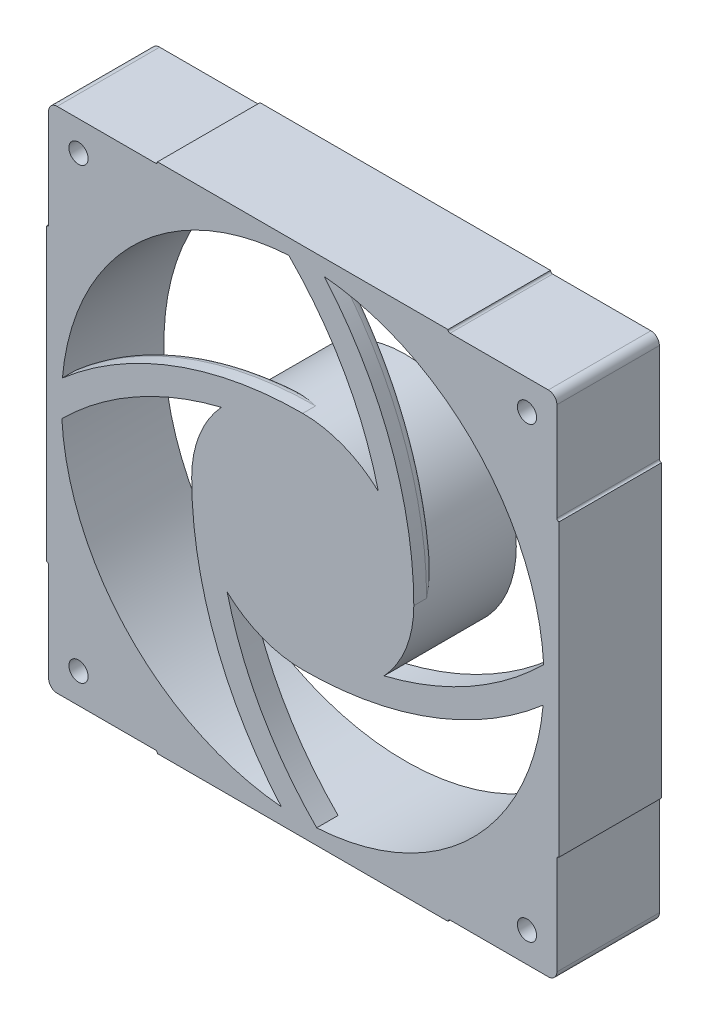
from build123d import *

# Parameters (mm, degrees)
ESQUISSE1_R             = 56.5
BOSS_EXTRU_1_DEPTH      = 24
ESQUISSE1_R_2           = 26
BOSS_EXTRU_1_2_DEPTH    = 24
ENL_V_MAT_EXTRU_1_DEPTH = 172.394282285
CONG_1_R                = 0.5
CONG_2_R                = 2
BOSS_EXTRU_2_START      = -5
BOSS_EXTRU_2_DEPTH      = 5
CONG_3_R                = 2
ESQUISSE4_R             = 2.25
ENL_V_MAT_EXTRU_2_DEPTH = 172.394282299


# Some blends are built 0.0001 mm under size
with BuildPart() as part:
    # Esquisse1 → Boss.-Extru.1 (new body)
    with BuildSketch(Plane.XY):
        Polygon((0, 95), (0, 0), (120, 0), (120, 120), (32.113356809, 120), (0.4, 120), (0, 120), (0, 114.342406945), align=None)
        with Locations((60, 60)):
            Circle(ESQUISSE1_R, mode=Mode.SUBTRACT)
    extrude(amount=BOSS_EXTRU_1_DEPTH)

    # Esquisse2 → Enlèv. mat.-Extru.1 (cut, through all)
    with BuildSketch(Plane.XY.offset(24)):
        Polygon((0, 94), (0.5, 94), (0.5, 119.5), (26, 119.5), (26, 120), (0, 120), align=None)
        Polygon((26, 0.5), (26, 0), (0, 0), (0, 26), (0.5, 26), (0.5, 0.5), align=None)
        Polygon((120, 0), (94, 0), (94, 0.5), (119.5, 0.5), (119.5, 26), (120, 26), align=None)
        Polygon((120, 120), (94, 120), (94, 119.5), (119.5, 119.5), (119.5, 94), (120, 94), align=None)
    extrude(amount=-ENL_V_MAT_EXTRU_1_DEPTH, mode=Mode.SUBTRACT)

    # Congé1
    cong_1_edges = [part.edges().sort_by_distance(p)[0] for p in [
        (94, 119.5, 12),
        (119.5, 94, 12),
        (94, 0.5, 12),
        (119.5, 26, 12),
        (26, 0.5, 12),
        (0.5, 26, 12),
        (0.5, 94, 12),
        (26, 119.5, 12),
    ]]
    fillet(cong_1_edges, radius=CONG_1_R - 0.0001)  # a hair under: the kernel refuses the full size

    # Congé2
    cong_2_edges = [part.edges().sort_by_distance(p)[0] for p in [
        (119.5, 119.5, 12),
        (119.5, 0.5, 12),
        (0.5, 0.5, 12),
        (0.5, 119.5, 12),
    ]]
    fillet(cong_2_edges, radius=CONG_2_R)



with BuildPart() as body_2:
    # Esquisse1 → Boss.-Extru.1 2 (new body)
    with BuildSketch(Plane.XY):
        with Locations((60, 60)):
            Circle(ESQUISSE1_R_2)
    extrude(amount=BOSS_EXTRU_1_2_DEPTH)


with BuildPart() as part_1:
    add(part.part)

    add(body_2.part)  # Boss.-Extru.2 merges body 2
    # Esquisse3 → Boss.-Extru.2 (add)
    with BuildSketch(Plane.XY.offset(24).offset(BOSS_EXTRU_2_START)):
        with BuildLine():
            ThreePointArc((3.724458924, 65.03125), (3.506910291, 60.883637464), (3.594634356, 56.73125))
            ThreePointArc((3.594634356, 56.73125), (20.845057368, 69.763102479), (40.955053164, 77.7))
            ThreePointArc((40.955053164, 77.7), (49.612507521, 83.834848437), (60, 86))
            ThreePointArc((60, 86), (29.972408521, 80.587491275), (3.724458924, 65.03125))
        make_face()
        with BuildLine():
            ThreePointArc((65.03125, 116.275541076), (60.883637464, 116.493089709), (56.73125, 116.405365644))
            ThreePointArc((56.73125, 116.405365644), (69.763102479, 99.154942632), (77.7, 79.044946836))
            ThreePointArc((77.7, 79.044946836), (83.834848437, 70.387492479), (86, 60))
            ThreePointArc((86, 60), (80.587491275, 90.027591479), (65.03125, 116.275541076))
        make_face()
        with BuildLine():
            ThreePointArc((60, 34), (90.027591479, 39.412508725), (116.275541076, 54.96875))
            ThreePointArc((116.275541076, 54.96875), (116.443857375, 57.481872801), (116.5, 60))
            ThreePointArc((116.5, 60), (116.476336456, 61.635059802), (116.405365644, 63.26875))
            ThreePointArc((116.405365644, 63.26875), (99.154942632, 50.236897521), (79.044946836, 42.3))
            ThreePointArc((79.044946836, 42.3), (70.387492479, 36.165151563), (60, 34))
        make_face()
        with BuildLine():
            ThreePointArc((34, 60), (39.412508725, 29.972408521), (54.96875, 3.724458924))
            ThreePointArc((54.96875, 3.724458924), (59.116362536, 3.506910291), (63.26875, 3.594634356))
            ThreePointArc((63.26875, 3.594634356), (50.236897521, 20.845057368), (42.3, 40.955053164))
            ThreePointArc((42.3, 40.955053164), (36.165151563, 49.612507521), (34, 60))
        make_face()
    extrude(amount=BOSS_EXTRU_2_DEPTH)

    # Congé3
    # the kernel refuses this fillet: 2 mm, written as the material it takes off along each edge
    with BuildSketch(Plane(origin=(60, 0, 19), x_dir=(0.17354982017034465, 0.9848250910282704, 0), z_dir=(0.9848250910282704, -0.17354982017034465, 0))) as cong_3_piece_1_section:
        with BuildLine():
            CenterArc((86 - CONG_3_R, CONG_3_R), CONG_3_R, 270, 90)
            Line((86, CONG_3_R), (86, 0))
            Line((86, 0), (86 - CONG_3_R, 0))
        make_face()
    cong_3_piece_1 = revolve(axis=Axis((60, 0, 19), (0, 0, 1)), revolution_arc=54.197355046, mode=Mode.PRIVATE)
    cong_3_piece_1 = cong_3_piece_1 & Plane(origin=(60, 60, 19), x_dir=(1, 0, 0), z_dir=(0, 0, -1)) * Cylinder(56.5, 344, mode=Mode.PRIVATE)
    cong_3_piece_1 = cong_3_piece_1 - Plane(origin=(60, 60, 19), x_dir=(1, 0, 0), z_dir=(0, 0, -1)) * Cylinder(26, 344, mode=Mode.PRIVATE)
    add(cong_3_piece_1, mode=Mode.SUBTRACT)
    with BuildSketch(Plane(origin=(0, 60, 19), x_dir=(0.9848250910282706, -0.17354982017034323, 0), z_dir=(-0.17354982017034323, -0.9848250910282706, 0))) as cong_3_piece_2_section:
        with BuildLine():
            CenterArc((86 - CONG_3_R, CONG_3_R), CONG_3_R, 270, 90)
            Line((86, CONG_3_R), (86, 0))
            Line((86, 0), (86 - CONG_3_R, 0))
        make_face()
    cong_3_piece_2 = revolve(axis=Axis((0, 60, 19), (0, 0, 1)), revolution_arc=54.197355046, mode=Mode.PRIVATE)
    cong_3_piece_2 = cong_3_piece_2 & Plane(origin=(60, 60, 19), x_dir=(1, 0, 0), z_dir=(0, 0, -1)) * Cylinder(56.5, 345, mode=Mode.PRIVATE)
    cong_3_piece_2 = cong_3_piece_2 - Plane(origin=(60, 60, 19), x_dir=(1, 0, 0), z_dir=(0, 0, -1)) * Cylinder(26, 345, mode=Mode.PRIVATE)
    add(cong_3_piece_2, mode=Mode.SUBTRACT)
    with BuildSketch(Plane(origin=(60, 120, 19), x_dir=(-0.17354982017035084, -0.9848250910282692, 0), z_dir=(-0.9848250910282692, 0.17354982017035084, 0))) as cong_3_piece_3_section:
        with BuildLine():
            CenterArc((86 - CONG_3_R, CONG_3_R), CONG_3_R, 270, 90)
            Line((86, CONG_3_R), (86, 0))
            Line((86, 0), (86 - CONG_3_R, 0))
        make_face()
    cong_3_piece_3 = revolve(axis=Axis((60, 120, 19), (0, 0, 1)), revolution_arc=54.197355046, mode=Mode.PRIVATE)
    cong_3_piece_3 = cong_3_piece_3 & Plane(origin=(60, 60, 19), x_dir=(1, 0, 0), z_dir=(0, 0, -1)) * Cylinder(56.5, 344, mode=Mode.PRIVATE)
    cong_3_piece_3 = cong_3_piece_3 - Plane(origin=(60, 60, 19), x_dir=(1, 0, 0), z_dir=(0, 0, -1)) * Cylinder(26, 344, mode=Mode.PRIVATE)
    add(cong_3_piece_3, mode=Mode.SUBTRACT)
    with BuildSketch(Plane(origin=(120, 60, 19), x_dir=(-0.9848250910282709, 0.17354982017034223, 0), z_dir=(0.17354982017034223, 0.9848250910282709, 0))) as cong_3_piece_4_section:
        with BuildLine():
            CenterArc((86 - CONG_3_R, CONG_3_R), CONG_3_R, 270, 90)
            Line((86, CONG_3_R), (86, 0))
            Line((86, 0), (86 - CONG_3_R, 0))
        make_face()
    cong_3_piece_4 = revolve(axis=Axis((120, 60, 19), (0, 0, 1)), revolution_arc=54.197355046, mode=Mode.PRIVATE)
    cong_3_piece_4 = cong_3_piece_4 & Plane(origin=(60, 60, 19), x_dir=(1, 0, 0), z_dir=(0, 0, -1)) * Cylinder(56.5, 344, mode=Mode.PRIVATE)
    cong_3_piece_4 = cong_3_piece_4 - Plane(origin=(60, 60, 19), x_dir=(1, 0, 0), z_dir=(0, 0, -1)) * Cylinder(26, 344, mode=Mode.PRIVATE)
    add(cong_3_piece_4, mode=Mode.SUBTRACT)

    # Esquisse4 → Enlèv. mat.-Extru.2 (cut, through all)
    with BuildSketch(Plane(origin=(0, 0, 0), x_dir=(-1, 0, 0), z_dir=(0, 0, -1))):
        with Locations((-7.5, 112.5)):
            Circle(ESQUISSE4_R)
        with Locations(Location((-112.5, 112.5, 0), (0, 0, 180))):
            Circle(ESQUISSE4_R)
        with Locations(Location((-7.5, 7.5, 0), (0, 0, 180))):
            Circle(ESQUISSE4_R)
        with Locations((-112.5, 7.5)):
            Circle(ESQUISSE4_R)
    extrude(amount=-ENL_V_MAT_EXTRU_2_DEPTH, mode=Mode.SUBTRACT)


solid = part_1.part
